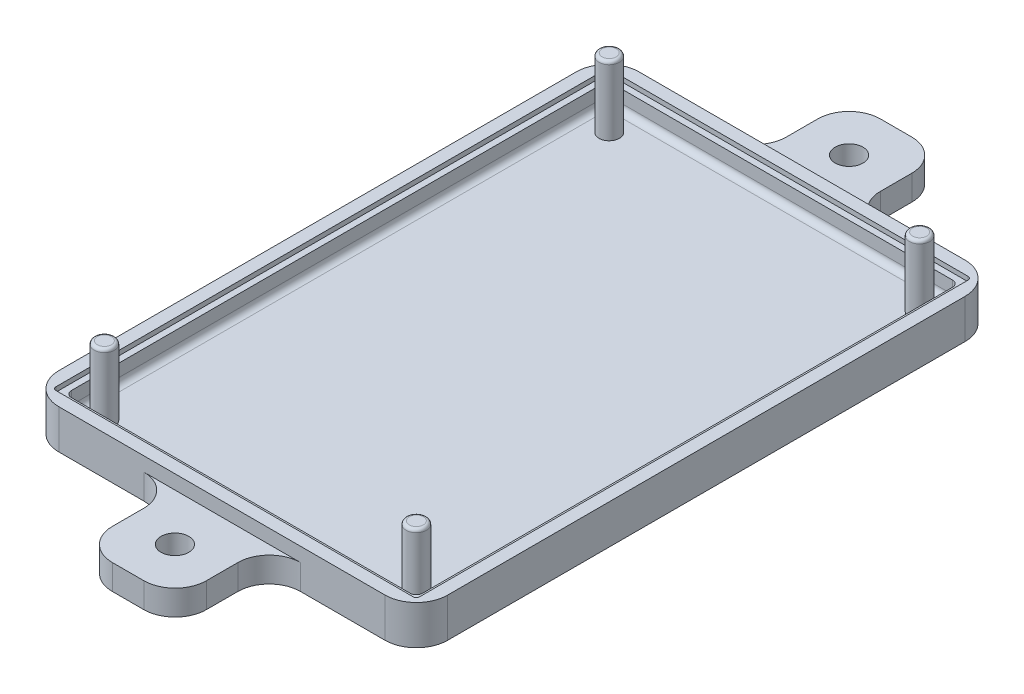
from build123d import *

# Parameters (mm, degrees)
SKETCH1_W           = 60.452
SKETCH1_H           = 91.44
BOSS_EXTRUDE4_DEPTH = 2.54
SKETCH7_W           = 65.532
SKETCH7_H           = 96.52
SKETCH7_W_2         = 60.452
SKETCH7_H_2         = 91.44
BOSS_EXTRUDE5_DEPTH = 6.35
SKETCH8_R           = 1.651
BOSS_EXTRUDE6_DEPTH = 11.176
SKETCH10_W          = 60.452
SKETCH10_H          = 91.44
SKETCH10_W_2        = 56.896
SKETCH10_H_2        = 87.884
BOSS_EXTRUDE7_DEPTH = 3.048
SKETCH13_W          = 60.452
SKETCH13_H          = 91.44
SKETCH13_W_2        = 58.928
SKETCH13_H_2        = 89.916
BOSS_EXTRUDE8_DEPTH = 0.762
CUT_EXTRUDE1_REACH  = 61.923
SKETCH14_W          = 65.532
SKETCH14_H          = 96.52
SKETCH14_W_2        = 62.992
SKETCH14_H_2        = 93.98
FILLET1_R           = 5.08
FILLET3_R           = 0.508
FILLET4_R           = 0.508
FILLET5_R           = 1.016
SKETCH16_W          = 15.24
SKETCH16_H          = 15.24
SKETCH16_R          = 2.2479
BOSS_EXTRUDE9_DEPTH = 4.064
FILLET8_R           = 5.08


with BuildPart() as part:
    # Sketch1 → Boss-Extrude4 (new body)
    with BuildSketch(Plane(origin=(0, 0, 0), x_dir=(1, 0, 0), z_dir=(0, 1, 0))):
        Rectangle(SKETCH1_W, SKETCH1_H)
    extrude(amount=BOSS_EXTRUDE4_DEPTH)

    # Sketch7 → Boss-Extrude5 (add)
    with BuildSketch(Plane.XZ):
        Rectangle(SKETCH7_W, SKETCH7_H)
        Rectangle(SKETCH7_W_2, SKETCH7_H_2, mode=Mode.SUBTRACT)
    extrude(amount=-BOSS_EXTRUDE5_DEPTH)

    # Sketch8 → Boss-Extrude6 (add)
    with BuildSketch(Plane(origin=(0, 2.54, 0), x_dir=(1, 0, 0), z_dir=(0, 1, 0))):
        with Locations(Location((-24.13, 39.878, 0), (0, 0, 90))):
            Circle(SKETCH8_R)
        with Locations(Location((26.162, 39.878, 0), (0, 0, 90))):
            Circle(SKETCH8_R)
        with Locations(Location((-24.638, -41.402, 0), (0, 0, 90))):
            Circle(SKETCH8_R)
        with Locations(Location((25.908, -41.402, 0), (0, 0, 90))):
            Circle(SKETCH8_R)
    extrude(amount=BOSS_EXTRUDE6_DEPTH)

    # Sketch10 → Boss-Extrude7 (add)
    with BuildSketch(Plane(origin=(0, 2.54, 0), x_dir=(1, 0, 0), z_dir=(0, 1, 0))):
        Rectangle(SKETCH10_W, SKETCH10_H)
        Rectangle(SKETCH10_W_2, SKETCH10_H_2, mode=Mode.SUBTRACT)
    extrude(amount=BOSS_EXTRUDE7_DEPTH)

    # Sketch13 → Boss-Extrude8 (add)
    with BuildSketch(Plane(origin=(0, 5.588, 0), x_dir=(1, 0, 0), z_dir=(0, 1, 0))):
        Rectangle(SKETCH13_W, SKETCH13_H)
        Rectangle(SKETCH13_W_2, SKETCH13_H_2, mode=Mode.SUBTRACT)
    extrude(amount=BOSS_EXTRUDE8_DEPTH)

    # Sketch14 → Cut-Extrude1 (cut, up to next)
    with BuildSketch(Plane.XZ, mode=Mode.PRIVATE) as cut_extrude1_sk1:
        Rectangle(SKETCH14_W, SKETCH14_H)
        Rectangle(SKETCH14_W_2, SKETCH14_H_2, mode=Mode.SUBTRACT)
    cut_extrude1_tool1 = extrude(cut_extrude1_sk1.sketch, amount=-CUT_EXTRUDE1_REACH, mode=Mode.PRIVATE) & part.part
    add(cut_extrude1_tool1.solids().sort_by_distance((0, 0, -47.093357))[0], mode=Mode.SUBTRACT)

    # Fillet1
    fillet1_edges = [part.edges().sort_by_distance(p)[0] for p in [
        (-31.496, 3.175, -46.99),
        (-31.496, 3.175, 46.99),
        (31.496, 3.175, 46.99),
        (31.496, 3.175, -46.99),
    ]]
    fillet(fillet1_edges, radius=FILLET1_R)

    # Fillet3
    fillet3_edges = [part.edges().sort_by_distance(p)[0] for p in [
        (-24.13, 13.716, -38.227),
        (-24.638, 13.716, 43.053),
        (26.162, 13.716, -38.227),
        (25.908, 13.716, 43.053),
    ]]
    fillet(fillet3_edges, radius=FILLET3_R)

    # Fillet4
    fillet4_edges = [part.edges().sort_by_distance(p)[0] for p in [
        (29.464, 5.969, 44.958),
        (29.464, 5.969, -44.958),
        (-29.464, 5.969, -44.958),
        (-29.464, 5.969, 44.958),
    ]]
    fillet(fillet4_edges, radius=FILLET4_R)

    # Fillet5
    # the kernel refuses this fillet: 1.016 mm, written as the material it adds along each edge
    with BuildSketch(Plane(origin=(-27.432, 3.556, 42.926), x_dir=(-1, 0, 0), z_dir=(0, 0, 1))) as fillet5_piece_1_section:
        Polygon((0, 0), (FILLET5_R, 0), (FILLET5_R, FILLET5_R), (0, FILLET5_R), align=None)
    fillet5_piece_1 = extrude(amount=FILLET5_R, mode=Mode.PRIVATE)
    fillet5_piece_1 = fillet5_piece_1 - Plane(origin=(-27.432, 3.556, 42.926), x_dir=(0.7071067811865475, 0.7071067811865475, 0), z_dir=(0, 0, 1)) * Sphere(FILLET5_R, mode=Mode.PRIVATE)
    add(fillet5_piece_1)
    with BuildSketch(Plane(origin=(27.432, 3.556, 42.926), x_dir=(0, 0, 1), z_dir=(1, 0, 0))) as fillet5_piece_2_section:
        Polygon((0, 0), (FILLET5_R, 0), (FILLET5_R, FILLET5_R), (0, FILLET5_R), align=None)
    fillet5_piece_2 = extrude(amount=FILLET5_R, mode=Mode.PRIVATE)
    fillet5_piece_2 = fillet5_piece_2 - Plane(origin=(27.432, 3.556, 42.926), x_dir=(0, 0.7071067811865475, -0.7071067811865475), z_dir=(1, 0, 0)) * Sphere(FILLET5_R, mode=Mode.PRIVATE)
    add(fillet5_piece_2)
    with BuildSketch(Plane(origin=(27.432, 3.556, -42.926), x_dir=(0, 0, -1), z_dir=(1, 0, 0))) as fillet5_piece_3_section:
        Polygon((0, 0), (FILLET5_R, 0), (FILLET5_R, -FILLET5_R), (0, -FILLET5_R), align=None)
    fillet5_piece_3 = extrude(amount=FILLET5_R, mode=Mode.PRIVATE)
    fillet5_piece_3 = fillet5_piece_3 - Plane(origin=(27.432, 3.556, -42.926), x_dir=(0, 0.7071067811865475, 0.7071067811865475), z_dir=(1, 0, 0)) * Sphere(FILLET5_R, mode=Mode.PRIVATE)
    add(fillet5_piece_3)
    with BuildSketch(Plane(origin=(-27.432, 3.556, -42.926), x_dir=(-1, 0, 0), z_dir=(0, 0, -1))) as fillet5_piece_4_section:
        Polygon((0, 0), (FILLET5_R, 0), (FILLET5_R, -FILLET5_R), (0, -FILLET5_R), align=None)
    fillet5_piece_4 = extrude(amount=FILLET5_R, mode=Mode.PRIVATE)
    fillet5_piece_4 = fillet5_piece_4 - Plane(origin=(-27.432, 3.556, -42.926), x_dir=(0.7071067811865475, 0.7071067811865475, 0), z_dir=(0, 0, -1)) * Sphere(FILLET5_R, mode=Mode.PRIVATE)
    add(fillet5_piece_4)
    with BuildSketch(Plane(origin=(-27.432, 2.54, 43.942), x_dir=(0, 1, 0), z_dir=(1, 0, 0)), Plane(origin=(27.432, 2.54, -43.942), x_dir=(0, 1, 0), z_dir=(-1, 0, 0))) as fillet5_piece_5:
        with BuildLine():
            CenterArc((FILLET5_R, -FILLET5_R), FILLET5_R, 90, 90)
            Line((0, -FILLET5_R), (0, 0))
            Line((0, 0), (FILLET5_R, 0))
        make_face()
    extrude(amount=54.864)
    with BuildSketch(Plane(origin=(28.448, 2.54, 42.926), x_dir=(0, 1, 0), z_dir=(0, 0, -1)), Plane(origin=(-28.448, 2.54, -42.926), x_dir=(0, 1, 0), z_dir=(0, 0, 1))) as fillet5_piece_6:
        with BuildLine():
            CenterArc((FILLET5_R, -FILLET5_R), FILLET5_R, 90, 90)
            Line((0, -FILLET5_R), (0, 0))
            Line((0, 0), (FILLET5_R, 0))
        make_face()
    extrude(amount=85.852)
    with BuildSketch(Plane(origin=(28.448, 3.556, 43.942), x_dir=(0, 0, -1), z_dir=(0, 1, 0)), Plane(origin=(-28.448, 3.556, 43.942), x_dir=(1, 0, 0), z_dir=(0, 1, 0))) as fillet5_piece_7:
        with BuildLine():
            CenterArc((FILLET5_R, FILLET5_R), FILLET5_R, 180, 90)
            Line((0, FILLET5_R), (0, 0))
            Line((0, 0), (FILLET5_R, 0))
        make_face()
    extrude(amount=2.032)
    with BuildSketch(Plane(origin=(28.448, 3.556, -43.942), x_dir=(0, 0, 1), z_dir=(0, 1, 0)), Plane(origin=(-28.448, 3.556, -43.942), x_dir=(1, 0, 0), z_dir=(0, 1, 0))) as fillet5_piece_8:
        with BuildLine():
            CenterArc((FILLET5_R, -FILLET5_R), FILLET5_R, 90, 90)
            Line((0, -FILLET5_R), (0, 0))
            Line((0, 0), (FILLET5_R, 0))
        make_face()
    extrude(amount=2.032)

    # Sketch16 → Boss-Extrude9 (add)
    # profile 1 of 2: a face of its own
    with BuildSketch(Plane.XZ):
        with Locations((0.031289089, 54.61)):
            Rectangle(SKETCH16_W, SKETCH16_H)
        with Locations(Location((0, 54.61, 0), (0, 0, 270))):
            Circle(SKETCH16_R, mode=Mode.SUBTRACT)
    # profile 2 of 2: a face of its own
    with BuildSketch(Plane.XZ):
        Polygon((7.62, -46.99), (0, -46.99), (-7.62, -46.99), (-7.62, -62.23), (7.62, -62.23), align=None)
        with Locations(Location((0, -54.61, 0), (0, 0, 270))):
            Circle(SKETCH16_R, mode=Mode.SUBTRACT)
    extrude(amount=-BOSS_EXTRUDE9_DEPTH)

    # Fillet8
    fillet8_edges = [part.edges().sort_by_distance(p)[0] for p in [
        (7.651289089, 2.032, 62.23),
        (7.651289089, 2.032, 46.99),
        (-7.588710911, 2.032, 46.99),
        (-7.588710911, 2.032, 62.23),
        (7.62, 2.032, -46.99),
        (7.62, 2.032, -62.23),
        (-7.62, 2.032, -62.23),
        (-7.62, 2.032, -46.99),
    ]]
    fillet(fillet8_edges, radius=FILLET8_R)


solid = part.part
